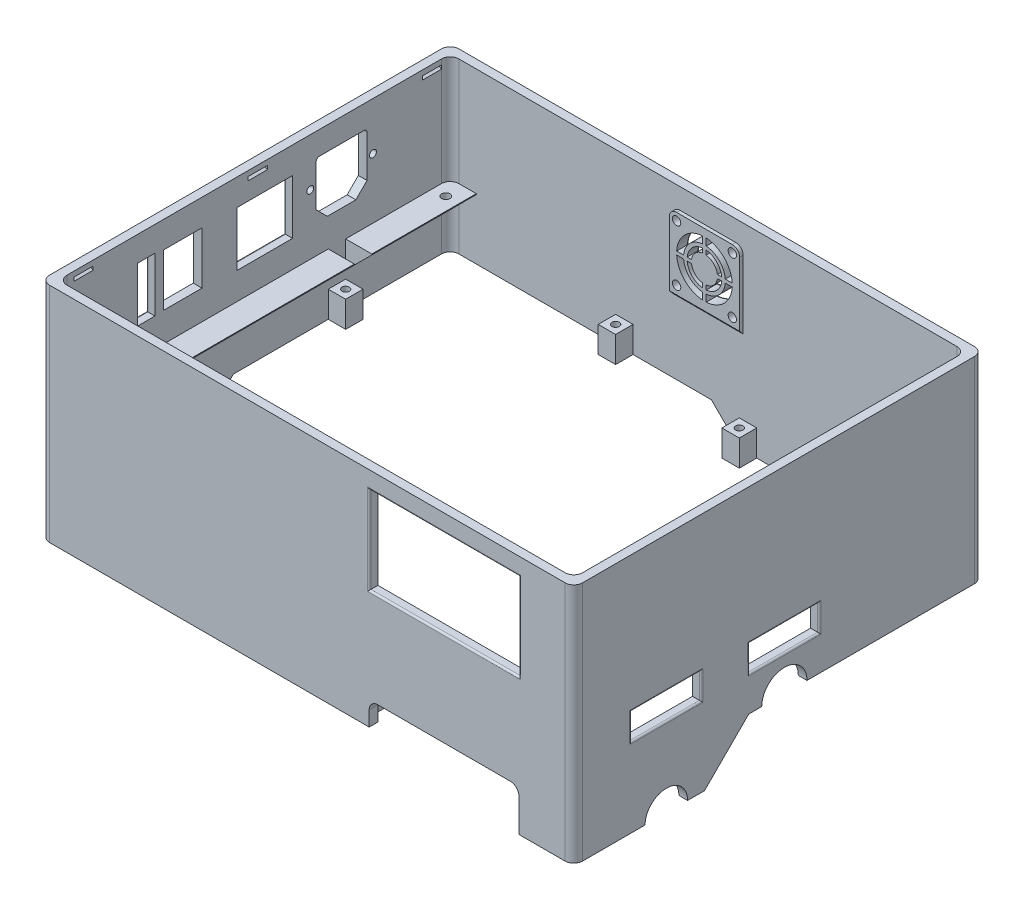
from build123d import *

# Parameters (mm, degrees)
BOSS_EXTRUDE1_DEPTH      = 70
BOSS_EXTRUDE1_DEPTH_BACK = 68.4
SKETCH1_W                = 306
SKETCH1_H                = 235
SKETCH1_W_2              = 296
SKETCH1_H_2              = 225
SKETCH2_W                = 86
SKETCH2_H                = 50
CUT_EXTRUDE1_DEPTH       = 5
SKETCH3_R                = 2
SKETCH3_W                = 22
SKETCH3_H                = 30
SKETCH3_W_2              = 10
SKETCH3_H_2              = 31.25
SKETCH3_W_3              = 30
SKETCH3_H_3              = 10
CUT_EXTRUDE2_DEPTH       = 5
SKETCH5_W                = 40
SKETCH5_H                = 15
CUT_EXTRUDE3_DEPTH       = 5
CUT_EXTRUDE4_DEPTH       = 334.604454248
CUT_EXTRUDE4_DEPTH_BACK  = 5
FILLET4_R                = 5
FILLET3_R                = 1
SKETCH7_W                = 15
SKETCH7_H                = 225
BOSS_EXTRUDE2_DEPTH      = 8
SKETCH8_W                = 10
SKETCH8_H                = 10
SKETCH8_R                = 2.1
BOSS_EXTRUDE3_DEPTH      = 15
SKETCH9_W                = 10
SKETCH9_H                = 10
SKETCH9_R                = 2.1
BOSS_EXTRUDE4_DEPTH      = 15
SKETCH10_W               = 10
SKETCH10_H               = 10
SKETCH10_R               = 2.1
BOSS_EXTRUDE5_DEPTH      = 15
SKETCH11_W               = 10
SKETCH11_H               = 10
SKETCH11_R               = 2.1
BOSS_EXTRUDE6_DEPTH      = 15
CHAMFER2_START           = -110.804206347
CHAMFER2_DEPTH           = 225
CHAMFER2_START_2         = -112
CHAMFER2_2_DEPTH         = 227
SKETCH12_W               = 17.921221932
SKETCH12_H               = 10
CUT_EXTRUDE5_DEPTH       = 20
FILLET5_R                = 5
SKETCH15_R               = 2.4
CUT_EXTRUDE7_DEPTH       = 5
CUT_EXTRUDE8_DEPTH       = 11
LPATTERN1_COUNT          = 3
LPATTERN1_PITCH          = 100
CUT_EXTRUDE9_DEPTH       = 11
LPATTERN2_COUNT          = 3
LPATTERN2_PITCH          = 110
CUT_EXTRUDE10_DEPTH      = 10
FILLET6_R                = 1
BOSS_EXTRUDE8_DEPTH      = 2
CHAMFER4_SIZE            = 3
CHAMFER4_SIZE_2          = 2.517298894
SKETCH20_R               = 2.4
CUT_EXTRUDE11_DEPTH      = 5
CUT_EXTRUDE12_REACH      = 337.773
SKETCH21_W               = 32
SKETCH21_H               = 31.25
FILLET7_R                = 1
SKETCH22_R               = 19
BOSS_EXTRUDE9_DEPTH      = 5
SKETCH23_W               = 5
SKETCH23_H               = 10
SKETCH23_W_2             = 10
CUT_EXTRUDE13_DEPTH      = 18


with BuildPart() as part:
    # Sketch1 → Boss-Extrude1 (new, two sides: drawn at the far end of the back side and taken through both)
    with BuildSketch(Plane(origin=(0, 0, 0), x_dir=(1, 0, 0), z_dir=(0, 1, 0)).offset(-BOSS_EXTRUDE1_DEPTH_BACK)):
        with Locations((73.201087296, -1.695793653)):
            Rectangle(SKETCH1_W, SKETCH1_H)
        with Locations((73.201087296, -1.695793653)):
            Rectangle(SKETCH1_W_2, SKETCH1_H_2, mode=Mode.SUBTRACT)
    extrude(amount=BOSS_EXTRUDE1_DEPTH + BOSS_EXTRUDE1_DEPTH_BACK)

    # Sketch2 → Cut-Extrude1 (cut)
    with BuildSketch(Plane.XY.offset(119.195793653)):
        with BuildLine():
            Line((108.701087296, -49.4), (108.701087296, -58))
            Line((108.701087296, -58), (-79.798912704, -58))
            Line((-79.798912704, -58), (-79.798912704, -68.4))
            Line((-79.798912704, -68.4), (194.701087296, -68.4))
            Line((194.701087296, -68.4), (194.701087296, -49.4))
            ThreePointArc((194.701087296, -49.4), (193.236621202, -45.864466094), (189.701087296, -44.4))
            Line((189.701087296, -44.4), (113.701087296, -44.4))
            ThreePointArc((113.701087296, -44.4), (110.16555339, -45.864466094), (108.701087296, -49.4))
        make_face()
        with Locations((151.701087296, 35)):
            Rectangle(SKETCH2_W, SKETCH2_H)
    extrude(amount=-CUT_EXTRUDE1_DEPTH, mode=Mode.SUBTRACT)

    # Sketch3 → Cut-Extrude2 (cut)
    with BuildSketch(Plane.ZY.offset(79.798912704)):
        with Locations((-30.464206347, 42.51)):
            Circle(SKETCH3_R)
        with Locations((-66.474206347, 42.51)):
            Circle(SKETCH3_R)
        with BuildLine():
            Line((114.195793653, -58), (88.695793653, -58))
            ThreePointArc((88.695793653, -58), (78.695793653, -48), (68.695793653, -58))
            Line((68.695793653, -58), (44.695793653, -58))
            Line((44.695793653, -58), (13.695793653, -27))
            Line((13.695793653, -27), (-115.804206347, -27))
            Line((-115.804206347, -27), (-115.804206347, -68.4))
            Line((-115.804206347, -68.4), (114.195793653, -68.4))
            Line((114.195793653, -68.4), (114.195793653, -58))
        make_face()
        with BuildLine():
            Line((-63.074206347, 30.92009185), (-56.664206347, 24.51009185))
            Line((-56.664206347, 24.51009185), (-40.284206347, 24.51009185))
            Line((-40.284206347, 24.51009185), (-33.864206347, 30.93009185))
            Line((-33.864206347, 30.93009185), (-33.864206347, 54.81))
            ThreePointArc((-33.864206347, 54.81), (-34.406058801, 56.118147545), (-35.714206347, 56.66))
            Line((-35.714206347, 56.66), (-61.224206347, 56.66))
            ThreePointArc((-61.224206347, 56.66), (-62.532321419, 56.118180019), (-63.074206347, 54.81009185))
            Line((-63.074206347, 54.81009185), (-63.074206347, 30.92009185))
        make_face()
        with Locations((42.695793653, 39.775)):
            Rectangle(SKETCH3_W, SKETCH3_H)
        with Locations((63.695793653, 40.025)):
            Rectangle(SKETCH3_W_2, SKETCH3_H_2)
        with Locations((79.195793653, -31)):
            Rectangle(SKETCH3_W_3, SKETCH3_H_3)
    extrude(amount=-CUT_EXTRUDE2_DEPTH, mode=Mode.SUBTRACT)

    # Sketch5 → Cut-Extrude3 (cut)
    with BuildSketch(Plane(origin=(226.201087296, 0, 0), x_dir=(0, 0, -1), z_dir=(1, 0, 0))):
        with Locations((-66.075793653, -15.5)):
            Rectangle(SKETCH5_W, SKETCH5_H)
        with Locations((1.724206347, -15.5)):
            Rectangle(SKETCH5_W, SKETCH5_H)
        with BuildLine():
            Line((-18.795793653, -43), (-44.195793653, -68.4))
            Line((-44.195793653, -68.4), (115.804206347, -68.4))
            Line((115.804206347, -68.4), (115.804206347, -43))
            Line((115.804206347, -43), (14.684206347, -43))
            ThreePointArc((14.684206347, -43), (1.684206347, -30), (-11.315793653, -43))
            Line((-11.315793653, -43), (-18.795793653, -43))
        make_face()
        with BuildLine():
            Line((-34.195793653, 23.141739257), (-34.195793653, 19.131280577))
            ThreePointArc((-34.195793653, 19.131280577), (-23.882085154, 23.786291501), (-19.227074231, 34.1))
            Line((-19.227074231, 34.1), (-23.23753291, 34.1))
            ThreePointArc((-23.23753291, 34.1), (-26.710512279, 26.614718626), (-34.195793653, 23.141739257))
        make_face()
        with BuildLine():
            Line((-47.154054396, 34.1), (-51.164513076, 34.1))
            ThreePointArc((-51.164513076, 34.1), (-46.509502152, 23.786291501), (-36.195793653, 19.131280577))
            Line((-36.195793653, 19.131280577), (-36.195793653, 23.141739257))
            ThreePointArc((-36.195793653, 23.141739257), (-43.681075028, 26.614718626), (-47.154054396, 34.1))
        make_face()
        with BuildLine():
            Line((-42.628828027, 34.1), (-45.145668024, 34.1))
            ThreePointArc((-45.145668024, 34.1), (-42.266861465, 28.028932188), (-36.195793653, 25.150125629))
            Line((-36.195793653, 25.150125629), (-36.195793653, 27.666965626))
            ThreePointArc((-36.195793653, 27.666965626), (-40.499094512, 29.796699141), (-42.628828027, 34.1))
        make_face()
        with BuildLine():
            Line((-34.195793653, 27.666965626), (-34.195793653, 25.150125629))
            ThreePointArc((-34.195793653, 25.150125629), (-28.124725842, 28.028932188), (-25.245919282, 34.1))
            Line((-25.245919282, 34.1), (-27.76275928, 34.1))
            ThreePointArc((-27.76275928, 34.1), (-29.892492794, 29.796699141), (-34.195793653, 27.666965626))
        make_face()
        with BuildLine():
            ThreePointArc((-36.195793653, 45.049874371), (-42.266861465, 42.171067812), (-45.145668024, 36.1))
            Line((-45.145668024, 36.1), (-42.628828027, 36.1))
            ThreePointArc((-42.628828027, 36.1), (-40.499094512, 40.403300859), (-36.195793653, 42.533034374))
            Line((-36.195793653, 42.533034374), (-36.195793653, 45.049874371))
        make_face()
        with BuildLine():
            ThreePointArc((-36.195793653, 51.068719423), (-46.509502152, 46.413708499), (-51.164513076, 36.1))
            Line((-51.164513076, 36.1), (-47.154054396, 36.1))
            ThreePointArc((-47.154054396, 36.1), (-43.681075028, 43.585281374), (-36.195793653, 47.058260743))
            Line((-36.195793653, 47.058260743), (-36.195793653, 51.068719423))
        make_face()
        with BuildLine():
            ThreePointArc((-25.245919282, 36.1), (-28.124725842, 42.171067812), (-34.195793653, 45.049874371))
            Line((-34.195793653, 45.049874371), (-34.195793653, 42.533034374))
            ThreePointArc((-34.195793653, 42.533034374), (-29.892492794, 40.403300859), (-27.76275928, 36.1))
            Line((-27.76275928, 36.1), (-25.245919282, 36.1))
        make_face()
        with BuildLine():
            ThreePointArc((-19.227074231, 36.1), (-23.882085154, 46.413708499), (-34.195793653, 51.068719423))
            Line((-34.195793653, 51.068719423), (-34.195793653, 47.058260743))
            ThreePointArc((-34.195793653, 47.058260743), (-26.710512279, 43.585281374), (-23.23753291, 36.1))
            Line((-23.23753291, 36.1), (-19.227074231, 36.1))
        make_face()
        with BuildLine():
            Line((-78.275793653, -68.4), (-53.875793653, -68.4))
            ThreePointArc((-53.875793653, -68.4), (-66.075793653, -56.2), (-78.275793653, -68.4))
        make_face()
    extrude(amount=-CUT_EXTRUDE3_DEPTH, mode=Mode.SUBTRACT)

    # Sketch6 → Cut-Extrude4 (cut, two sides: drawn at the far end of the back side and taken through both)
    with BuildSketch(Plane(origin=(0, 0, -115.804206347), x_dir=(-1, 0, 0), z_dir=(0, 0, -1)).offset(-CUT_EXTRUDE4_DEPTH_BACK)):
        Polygon((727.823018006, -27), (74.798912704, -27), (-75.201087296, -27), (-91.201087296, -43), (-221.201087296, -43), (-874.225192599, -43), (-861.182058727, -1348.983079937), (740.866151878, -1332.983079937), align=None)
    extrude(amount=CUT_EXTRUDE4_DEPTH + CUT_EXTRUDE4_DEPTH_BACK, mode=Mode.SUBTRACT)

    # Fillet4
    fillet4_edges = [part.edges().sort_by_distance(p)[0] for p in [
        (-79.798912704, 21.5, -115.804206347),
        (226.201087296, 13.5, -115.804206347),
        (-79.798912704, 6, 119.195793653),
        (226.201087296, 0.8, 119.195793653),
    ]]
    fillet(fillet4_edges, radius=FILLET4_R)

    # Fillet3
    fillet3_edges = [part.edges().sort_by_distance(p)[0] for p in [
        (-79.798912704, 40.025, 68.695793653),
        (-79.798912704, 55.65, 63.695793653),
        (-79.798912704, 40.025, 58.695793653),
        (-79.798912704, 24.4, 63.695793653),
        (-79.798912704, -31, 94.195793653),
        (-79.798912704, -26, 79.195793653),
        (-79.798912704, -31, 64.195793653),
        (-79.798912704, -36, 79.195793653),
        (226.201087296, 40.403300859, 40.499094512),
        (226.201087296, 43.791454372, 36.195793653),
        (226.201087296, 42.171067812, 42.266861465),
        (226.201087296, 36.1, 43.887248026),
        (226.201087296, 43.585281374, 43.681075028),
        (226.201087296, 49.063490083, 36.195793653),
        (226.201087296, 46.413708499, 46.509502152),
        (226.201087296, 36.1, 49.159283736),
        (226.201087296, 26.408545628, 34.195793653),
        (226.201087296, 29.796699141, 29.892492794),
        (226.201087296, 34.1, 26.504339281),
        (226.201087296, 28.028932188, 28.124725842),
        (226.201087296, 34.1, 43.887248026),
        (226.201087296, 29.796699141, 40.499094512),
        (226.201087296, 28.028932188, 42.266861465),
        (226.201087296, 26.408545628, 36.195793653),
        (226.201087296, 26.614718626, 43.681075028),
        (226.201087296, 34.1, 49.159283736),
        (226.201087296, 23.786291501, 46.509502152),
        (226.201087296, 21.136509917, 36.195793653),
        (226.201087296, 26.614718626, 26.710512279),
        (226.201087296, 34.1, 21.23230357),
        (226.201087296, 21.136509917, 34.195793653),
        (226.201087296, 23.786291501, 23.882085154),
        (226.201087296, -15.5, -21.724206347),
        (226.201087296, -8, -1.724206347),
        (226.201087296, -15.5, 18.275793653),
        (226.201087296, -23, -1.724206347),
        (226.201087296, 43.585281374, 26.710512279),
        (226.201087296, 49.063490083, 34.195793653),
        (226.201087296, 36.1, 21.23230357),
        (226.201087296, 46.413708499, 23.882085154),
        (226.201087296, 40.403300859, 29.892492794),
        (226.201087296, 43.791454372, 34.195793653),
        (226.201087296, 36.1, 26.504339281),
        (226.201087296, 42.171067812, 28.124725842),
        (226.201087296, -15.5, 46.075793653),
        (226.201087296, -8, 66.075793653),
        (226.201087296, -15.5, 86.075793653),
        (226.201087296, -23, 66.075793653),
        (151.701087296, 60, 119.195793653),
        (108.701087296, 35, 119.195793653),
        (151.701087296, 10, 119.195793653),
        (194.701087296, 35, 119.195793653),
    ]]
    fillet(fillet3_edges, radius=FILLET3_R - 0.0001)  # a hair under: the kernel refuses the full size

    # Sketch7 → Boss-Extrude2 (add)
    with BuildSketch(Plane(origin=(0, 0, 0), x_dir=(1, 0, 0), z_dir=(0, 1, 0))):
        with Locations((-67.298912704, -1.695793653)):
            Rectangle(SKETCH7_W, SKETCH7_H)
        with Locations((213.701087296, -1.695793653)):
            Rectangle(SKETCH7_W, SKETCH7_H)
    extrude(amount=BOSS_EXTRUDE2_DEPTH)

    # Sketch8 → Boss-Extrude3 (add)
    with BuildSketch(Plane.XZ.offset(68.4)):
        with Locations((216.201087296, 109.195793653)):
            Rectangle(SKETCH8_W, SKETCH8_H)
        with Locations(Location((216.201087296, 109.195793653, 0), (0, 0, 270))):
            Circle(SKETCH8_R, mode=Mode.SUBTRACT)
    extrude(amount=-BOSS_EXTRUDE3_DEPTH)

    # Sketch9 → Boss-Extrude4 (add)
    # profile 1 of 4: a face of its own
    with BuildSketch(Plane.XZ.offset(58)):
        with Locations((98.701087296, 109.195793653)):
            Rectangle(SKETCH9_W, SKETCH9_H)
        with Locations(Location((98.701087296, 109.195793653, 0), (0, 0, 270))):
            Circle(SKETCH9_R, mode=Mode.SUBTRACT)
    # profile 2 of 4: a face of its own
    with BuildSketch(Plane.XZ.offset(58)):
        with Locations((-1.298912704, 109.195793653)):
            Rectangle(SKETCH9_W, SKETCH9_H)
        with Locations(Location((-1.298912704, 109.195793653, 0), (0, 0, 270))):
            Circle(SKETCH9_R, mode=Mode.SUBTRACT)
    # profile 3 of 4: a face of its own
    with BuildSketch(Plane.XZ.offset(58)):
        with Locations((-69.798912704, 109.195793653)):
            Rectangle(SKETCH9_W, SKETCH9_H)
        with Locations(Location((-69.798912704, 109.195793653, 0), (0, 0, 270))):
            Circle(SKETCH9_R, mode=Mode.SUBTRACT)
    # profile 4 of 4: a face of its own
    with BuildSketch(Plane.XZ.offset(58)):
        with Locations((-69.798912704, 49.695793653)):
            Rectangle(SKETCH9_W, SKETCH9_H)
        with Locations(Location((-69.798912704, 49.545793653, 0), (0, 0, 270))):
            Circle(SKETCH9_R, mode=Mode.SUBTRACT)
    extrude(amount=-BOSS_EXTRUDE4_DEPTH)

    # Sketch10 → Boss-Extrude5 (add)
    # profile 1 of 4: a face of its own
    with BuildSketch(Plane.XZ.offset(43)):
        with Locations((216.201087296, -42.804206347)):
            Rectangle(SKETCH10_W, SKETCH10_H)
        with Locations(Location((216.201087296, -42.804206347, 0), (0, 0, 270))):
            Circle(SKETCH10_R, mode=Mode.SUBTRACT)
    # profile 2 of 4: a face of its own
    with BuildSketch(Plane.XZ.offset(43)):
        with Locations((216.201087296, -105.804206347)):
            Rectangle(SKETCH10_W, SKETCH10_H)
        with Locations(Location((216.201087296, -105.804206347, 0), (0, 0, 270))):
            Circle(SKETCH10_R, mode=Mode.SUBTRACT)
    # profile 3 of 4: a face of its own
    with BuildSketch(Plane.XZ.offset(43)):
        with Locations((151.201087296, -105.804206347)):
            Rectangle(SKETCH10_W, SKETCH10_H)
        with Locations(Location((151.201087296, -105.804206347, 0), (0, 0, 270))):
            Circle(SKETCH10_R, mode=Mode.SUBTRACT)
    # profile 4 of 4: a face of its own
    with BuildSketch(Plane.XZ.offset(43)):
        with Locations((96.201087296, -105.804206347)):
            Rectangle(SKETCH10_W, SKETCH10_H)
        with Locations(Location((96.201087296, -105.804206347, 0), (0, 0, 270))):
            Circle(SKETCH10_R, mode=Mode.SUBTRACT)
    extrude(amount=-BOSS_EXTRUDE5_DEPTH)

    # Sketch11 → Boss-Extrude6 (add)
    # profile 1 of 2: a face of its own
    with BuildSketch(Plane.XZ.offset(27)):
        with Locations((-69.798912704, -45.804206347)):
            Rectangle(SKETCH11_W, SKETCH11_H)
        with Locations(Location((-69.798912704, -45.804206347, 0), (0, 0, 270))):
            Circle(SKETCH11_R, mode=Mode.SUBTRACT)
    # profile 2 of 2: a face of its own
    with BuildSketch(Plane.XZ.offset(27)):
        with Locations((25.201087296, -105.804206347)):
            Rectangle(SKETCH11_W, SKETCH11_H)
        with Locations(Location((25.201087296, -105.804206347, 0), (0, 0, 270))):
            Circle(SKETCH11_R, mode=Mode.SUBTRACT)
    extrude(amount=-BOSS_EXTRUDE6_DEPTH)

    # Chamfer2: read off the stored shape, not the designer's step
    # Chamfer2 outline → Chamfer2 (cut)
    with BuildSketch(Plane.XY.offset(CHAMFER2_START)):
        Polygon((-59.798912704, 7.5), (-67.298912704, 0), (-59.798912704, 0), align=None)
        Polygon((206.201087296, 0), (213.701087296, 0), (206.201087296, 7.5), align=None)
    extrude(amount=CHAMFER2_DEPTH, mode=Mode.SUBTRACT)

    # Chamfer2 2 outline → Chamfer2 2 (add)
    with BuildSketch(Plane.XY.offset(CHAMFER2_START_2)):
        Polygon((-74.798912704, 0), (-74.798912704, -7.5), (-67.298912704, 0), align=None)
        Polygon((221.201087296, 0), (213.701087296, 0), (221.201087296, -7.5), align=None)
    extrude(amount=CHAMFER2_2_DEPTH)

    # Sketch12 → Cut-Extrude5 (cut)
    with BuildSketch(Plane(origin=(0, -12, 0), x_dir=(1, 0, 0), z_dir=(0, 1, 0))):
        with Locations((-65.838301738, 45.804206347)):
            Rectangle(SKETCH12_W, SKETCH12_H)
    extrude(amount=CUT_EXTRUDE5_DEPTH, mode=Mode.SUBTRACT)

    # Fillet5
    fillet5_edges = [part.edges().sort_by_distance(p)[0] for p in [
        (-74.798912704, 39, -110.804206347),
        (-74.798912704, 39, 114.195793653),
        (221.201087296, 39, -110.804206347),
        (221.201087296, 39, 114.195793653),
        (-74.798912704, -17.25, -110.804206347),
    ]]
    fillet(fillet5_edges, radius=FILLET5_R)

    # Sketch15 → Cut-Extrude7 (cut)
    with BuildSketch(Plane(origin=(0, 8, 0), x_dir=(1, 0, 0), z_dir=(0, 1, 0))):
        with Locations(Location((213.701087296, 100.804206347, 0), (0, 0, 270))):
            Circle(SKETCH15_R)
        with Locations(Location((213.701087296, -104.195793653, 0), (0, 0, 270))):
            Circle(SKETCH15_R)
        with Locations(Location((-67.298912704, -104.195793653, 0), (0, 0, 270))):
            Circle(SKETCH15_R)
        with Locations(Location((-67.298912704, 100.804206347, 0), (0, 0, 270))):
            Circle(SKETCH15_R)
    extrude(amount=-CUT_EXTRUDE7_DEPTH, mode=Mode.SUBTRACT)

    # Sketch16 → Cut-Extrude8 (cut)
    with BuildSketch(Plane.XY.offset(-105.804206347)):
        Polygon((-74.798912704, 64.9), (-74.798912704, 67), (-76.798912704, 65.95), align=None)
        Polygon((221.201087296, 67), (221.201087296, 64.9), (223.201087296, 65.95), align=None)
    cut_extrude8 = extrude(amount=CUT_EXTRUDE8_DEPTH, mode=Mode.SUBTRACT)

    # LPattern1: Cut-Extrude8 ×3
    with Locations(*[(0, 0, i * LPATTERN1_PITCH) for i in range(1, LPATTERN1_COUNT)]):
        add(cut_extrude8, mode=Mode.SUBTRACT)

    # Sketch17 → Cut-Extrude9 (cut)
    with BuildSketch(Plane(origin=(10.201087296, 0, 0), x_dir=(0, 0, -1), z_dir=(1, 0, 0))):
        Polygon((-114.195793653, 64.9), (-114.195793653, 67), (-116.195793653, 65.95), align=None)
    cut_extrude9 = extrude(amount=CUT_EXTRUDE9_DEPTH, mode=Mode.SUBTRACT)

    # LPattern2: Cut-Extrude9 ×3
    with Locations(*[(i * LPATTERN2_PITCH, 0, 0) for i in range(1, LPATTERN2_COUNT)]):
        add(cut_extrude9, mode=Mode.SUBTRACT)

    # Sketch18 → Cut-Extrude10 (cut)
    with BuildSketch(Plane(origin=(0, 0, -115.804206347), x_dir=(-1, 0, 0), z_dir=(0, 0, -1))):
        with BuildLine():
            ThreePointArc((-74.201087296, 47.949874371), (-80.272155108, 45.071067812), (-83.150961667, 39))
            Line((-83.150961667, 39), (-80.63412167, 39))
            ThreePointArc((-80.63412167, 39), (-78.504388155, 43.303300859), (-74.201087296, 45.433034374))
            Line((-74.201087296, 45.433034374), (-74.201087296, 47.949874371))
        make_face()
        with BuildLine():
            Line((-65.768052922, 39), (-63.251212925, 39))
            ThreePointArc((-63.251212925, 39), (-66.130019484, 45.071067812), (-72.201087296, 47.949874371))
            Line((-72.201087296, 47.949874371), (-72.201087296, 45.433034374))
            ThreePointArc((-72.201087296, 45.433034374), (-67.897786437, 43.303300859), (-65.768052922, 39))
        make_face()
        with BuildLine():
            ThreePointArc((-83.150961667, 37), (-80.272155108, 30.928932188), (-74.201087296, 28.050125629))
            Line((-74.201087296, 28.050125629), (-74.201087296, 30.566965626))
            ThreePointArc((-74.201087296, 30.566965626), (-78.504388155, 32.696699141), (-80.63412167, 37))
            Line((-80.63412167, 37), (-83.150961667, 37))
        make_face()
        with BuildLine():
            Line((-72.201087296, 30.566965626), (-72.201087296, 28.050125629))
            ThreePointArc((-72.201087296, 28.050125629), (-66.130019484, 30.928932188), (-63.251212925, 37))
            Line((-63.251212925, 37), (-65.768052922, 37))
            ThreePointArc((-65.768052922, 37), (-67.897786437, 32.696699141), (-72.201087296, 30.566965626))
        make_face()
        with BuildLine():
            Line((-72.201087296, 26.041739257), (-72.201087296, 22.031280577))
            ThreePointArc((-72.201087296, 22.031280577), (-61.887378797, 26.686291501), (-57.232367873, 37))
            Line((-57.232367873, 37), (-61.242826553, 37))
            ThreePointArc((-61.242826553, 37), (-64.715805922, 29.514718626), (-72.201087296, 26.041739257))
        make_face()
        with BuildLine():
            Line((-61.242826553, 39), (-57.232367873, 39))
            ThreePointArc((-57.232367873, 39), (-61.887378797, 49.313708499), (-72.201087296, 53.968719423))
            Line((-72.201087296, 53.968719423), (-72.201087296, 49.958260743))
            ThreePointArc((-72.201087296, 49.958260743), (-64.715805922, 46.485281374), (-61.242826553, 39))
        make_face()
        with BuildLine():
            ThreePointArc((-74.201087296, 53.968719423), (-84.514795795, 49.313708499), (-89.169806719, 39))
            Line((-89.169806719, 39), (-85.159348039, 39))
            ThreePointArc((-85.159348039, 39), (-81.68636867, 46.485281374), (-74.201087296, 49.958260743))
            Line((-74.201087296, 49.958260743), (-74.201087296, 53.968719423))
        make_face()
        with BuildLine():
            ThreePointArc((-89.169806719, 37), (-84.514795795, 26.686291501), (-74.201087296, 22.031280577))
            Line((-74.201087296, 22.031280577), (-74.201087296, 26.041739257))
            ThreePointArc((-74.201087296, 26.041739257), (-81.68636867, 29.514718626), (-85.159348039, 37))
            Line((-85.159348039, 37), (-89.169806719, 37))
        make_face()
    extrude(amount=-CUT_EXTRUDE10_DEPTH, mode=Mode.SUBTRACT)

    # Fillet6
    fillet6_edges = [part.edges().sort_by_distance(p)[0] for p in [
        (59.237597213, 39, -115.804206347),
        (61.887378797, 49.313708499, -115.804206347),
        (81.68636867, 46.485281374, -115.804206347),
        (74.201087296, 51.963490083, -115.804206347),
        (84.514795795, 49.313708499, -115.804206347),
        (87.164577379, 39, -115.804206347),
        (81.68636867, 29.514718626, -115.804206347),
        (87.164577379, 37, -115.804206347),
        (84.514795795, 26.686291501, -115.804206347),
        (74.201087296, 24.036509917, -115.804206347),
        (78.504388155, 43.303300859, -115.804206347),
        (74.201087296, 46.691454372, -115.804206347),
        (80.272155108, 45.071067812, -115.804206347),
        (81.892541668, 39, -115.804206347),
        (67.897786437, 32.696699141, -115.804206347),
        (64.509632924, 37, -115.804206347),
        (72.201087296, 29.308545628, -115.804206347),
        (66.130019484, 30.928932188, -115.804206347),
        (64.715805922, 29.514718626, -115.804206347),
        (59.237597213, 37, -115.804206347),
        (72.201087296, 24.036509917, -115.804206347),
        (61.887378797, 26.686291501, -115.804206347),
        (78.504388155, 32.696699141, -115.804206347),
        (81.892541668, 37, -115.804206347),
        (80.272155108, 30.928932188, -115.804206347),
        (74.201087296, 29.308545628, -115.804206347),
        (67.897786437, 43.303300859, -115.804206347),
        (72.201087296, 46.691454372, -115.804206347),
        (64.509632924, 39, -115.804206347),
        (66.130019484, 45.071067812, -115.804206347),
        (64.715805922, 46.485281374, -115.804206347),
        (72.201087296, 51.963490083, -115.804206347),
    ]]
    fillet(fillet6_edges, radius=FILLET6_R - 0.0001)  # a hair under: the kernel refuses the full size

    # Sketch19 → Boss-Extrude8 (add)
    with BuildSketch(Plane(origin=(0, -22.804206347, -110.804206347), x_dir=(1, 0, 0), z_dir=(0, 0, 1))):
        with BuildLine():
            Line((53.001087296, 76.804206347), (53.001087296, 40.604206347))
            Line((53.001087296, 40.604206347), (93.401087296, 40.604206347))
            Line((93.401087296, 40.604206347), (93.401087296, 76.804206347))
            ThreePointArc((93.401087296, 76.804206347), (92.170935777, 79.774054828), (89.201087296, 81.004206347))
            Line((89.201087296, 81.004206347), (57.201087296, 81.004206347))
            ThreePointArc((57.201087296, 81.004206347), (54.231238815, 79.774054828), (53.001087296, 76.804206347))
        make_face()
        with BuildLine():
            Line((72.201087296, 48.845945604), (72.201087296, 44.835486924))
            ThreePointArc((72.201087296, 44.835486924), (61.887378797, 49.490497848), (57.232367873, 59.804206347))
            Line((57.232367873, 59.804206347), (61.242826553, 59.804206347))
            ThreePointArc((61.242826553, 59.804206347), (64.715805922, 52.318924972), (72.201087296, 48.845945604))
        make_face(mode=Mode.SUBTRACT)
        with BuildLine():
            Line((72.201087296, 53.371171973), (72.201087296, 50.854331976))
            ThreePointArc((72.201087296, 50.854331976), (66.130019484, 53.733138535), (63.251212925, 59.804206347))
            Line((63.251212925, 59.804206347), (65.768052922, 59.804206347))
            ThreePointArc((65.768052922, 59.804206347), (67.897786437, 55.500905488), (72.201087296, 53.371171973))
        make_face(mode=Mode.SUBTRACT)
        with BuildLine():
            Line((85.159348039, 59.804206347), (89.169806719, 59.804206347))
            ThreePointArc((89.169806719, 59.804206347), (84.514795795, 49.490497848), (74.201087296, 44.835486924))
            Line((74.201087296, 44.835486924), (74.201087296, 48.845945604))
            ThreePointArc((74.201087296, 48.845945604), (81.68636867, 52.318924972), (85.159348039, 59.804206347))
        make_face(mode=Mode.SUBTRACT)
        with BuildLine():
            Line((80.63412167, 59.804206347), (83.150961667, 59.804206347))
            ThreePointArc((83.150961667, 59.804206347), (80.272155108, 53.733138535), (74.201087296, 50.854331976))
            Line((74.201087296, 50.854331976), (74.201087296, 53.371171973))
            ThreePointArc((74.201087296, 53.371171973), (78.504388155, 55.500905488), (80.63412167, 59.804206347))
        make_face(mode=Mode.SUBTRACT)
        with BuildLine():
            ThreePointArc((72.201087296, 68.23724072), (67.897786437, 66.107507206), (65.768052922, 61.804206347))
            Line((65.768052922, 61.804206347), (63.251212925, 61.804206347))
            ThreePointArc((63.251212925, 61.804206347), (66.130019484, 67.875274158), (72.201087296, 70.754080718))
            Line((72.201087296, 70.754080718), (72.201087296, 68.23724072))
        make_face(mode=Mode.SUBTRACT)
        with BuildLine():
            ThreePointArc((72.201087296, 72.76246709), (64.715805922, 69.289487721), (61.242826553, 61.804206347))
            Line((61.242826553, 61.804206347), (57.232367873, 61.804206347))
            ThreePointArc((57.232367873, 61.804206347), (61.887378797, 72.117914846), (72.201087296, 76.772925769))
            Line((72.201087296, 76.772925769), (72.201087296, 72.76246709))
        make_face(mode=Mode.SUBTRACT)
        with BuildLine():
            ThreePointArc((74.201087296, 70.754080718), (80.272155108, 67.875274158), (83.150961667, 61.804206347))
            Line((83.150961667, 61.804206347), (80.63412167, 61.804206347))
            ThreePointArc((80.63412167, 61.804206347), (78.504388155, 66.107507206), (74.201087296, 68.23724072))
            Line((74.201087296, 68.23724072), (74.201087296, 70.754080718))
        make_face(mode=Mode.SUBTRACT)
        with BuildLine():
            ThreePointArc((85.159348039, 61.804206347), (81.68636867, 69.289487721), (74.201087296, 72.76246709))
            Line((74.201087296, 72.76246709), (74.201087296, 76.772925769))
            ThreePointArc((74.201087296, 76.772925769), (84.514795795, 72.117914846), (89.169806719, 61.804206347))
            Line((89.169806719, 61.804206347), (85.159348039, 61.804206347))
        make_face(mode=Mode.SUBTRACT)
    extrude(amount=BOSS_EXTRUDE8_DEPTH)

    # Chamfer4
    # the kernel refuses this chamfer: 3, 2.517298894 mm, written as the material it adds along each edge
    with BuildSketch(Plane(origin=(53.001087296, 17.8, -110.804206347), x_dir=(0, -1, 0), z_dir=(1, 0, 0))) as chamfer4_piece_1_section:
        Polygon((CHAMFER4_SIZE, 0), (0, -CHAMFER4_SIZE_2), (0, 0), align=None)
    chamfer4_piece_1 = extrude(amount=40.4, mode=Mode.PRIVATE)
    chamfer4_piece_1 = split(chamfer4_piece_1, bisect_by=Plane(origin=(53.001087296, 17.8, -108.804206347), z_dir=(0, 0, -1)), keep=Keep.TOP, mode=Mode.PRIVATE)
    add(chamfer4_piece_1)

    # Sketch20 → Cut-Extrude11 (cut)
    with BuildSketch(Plane.XY.offset(-108.804206347)):
        with Locations((57.201087296, 54)):
            Circle(SKETCH20_R)
        with Locations((89.201087296, 54)):
            Circle(SKETCH20_R)
        with Locations((89.201087296, 22)):
            Circle(SKETCH20_R)
        with Locations((57.201087296, 22)):
            Circle(SKETCH20_R)
    extrude(amount=-CUT_EXTRUDE11_DEPTH, mode=Mode.SUBTRACT)

    # Sketch21 → Cut-Extrude12 (cut, up to next)
    with BuildSketch(Plane.ZY.offset(79.798912704), mode=Mode.PRIVATE) as cut_extrude12_sk1:
        with Locations((-4.304206347, 39.15)):
            Rectangle(SKETCH21_W, SKETCH21_H)
    cut_extrude12_tool1 = extrude(cut_extrude12_sk1.sketch, amount=-CUT_EXTRUDE12_REACH, mode=Mode.PRIVATE) & part.part
    add(cut_extrude12_tool1.solids().sort_by_distance((-79.798913, 39.15, -4.304206))[0], mode=Mode.SUBTRACT)

    # Fillet7
    fillet7_edges = [part.edges().sort_by_distance(p)[0] for p in [
        (-79.798912704, 39.15, 11.695793653),
        (-79.798912704, 54.775, -4.304206347),
        (-79.798912704, 39.15, -20.304206347),
        (-79.798912704, 23.525, -4.304206347),
    ]]
    fillet(fillet7_edges, radius=FILLET7_R)

    # Sketch22 → Boss-Extrude9 (add)
    with BuildSketch(Plane(origin=(226.201087296, 0, 0), x_dir=(0, 0, -1), z_dir=(1, 0, 0))):
        with Locations((-35.195793653, 35.1)):
            Circle(SKETCH22_R)
    extrude(amount=-BOSS_EXTRUDE9_DEPTH)

    # Sketch23 → Cut-Extrude13 (cut)
    with BuildSketch(Plane(origin=(0, 8, 0), x_dir=(1, 0, 0), z_dir=(0, 1, 0))):
        with Locations((208.701087296, 42.804206347)):
            Rectangle(SKETCH23_W, SKETCH23_H)
        with Locations((216.201087296, 42.804206347)):
            Rectangle(SKETCH23_W_2, SKETCH23_H)
    extrude(amount=-CUT_EXTRUDE13_DEPTH, mode=Mode.SUBTRACT)


solid = part.part
